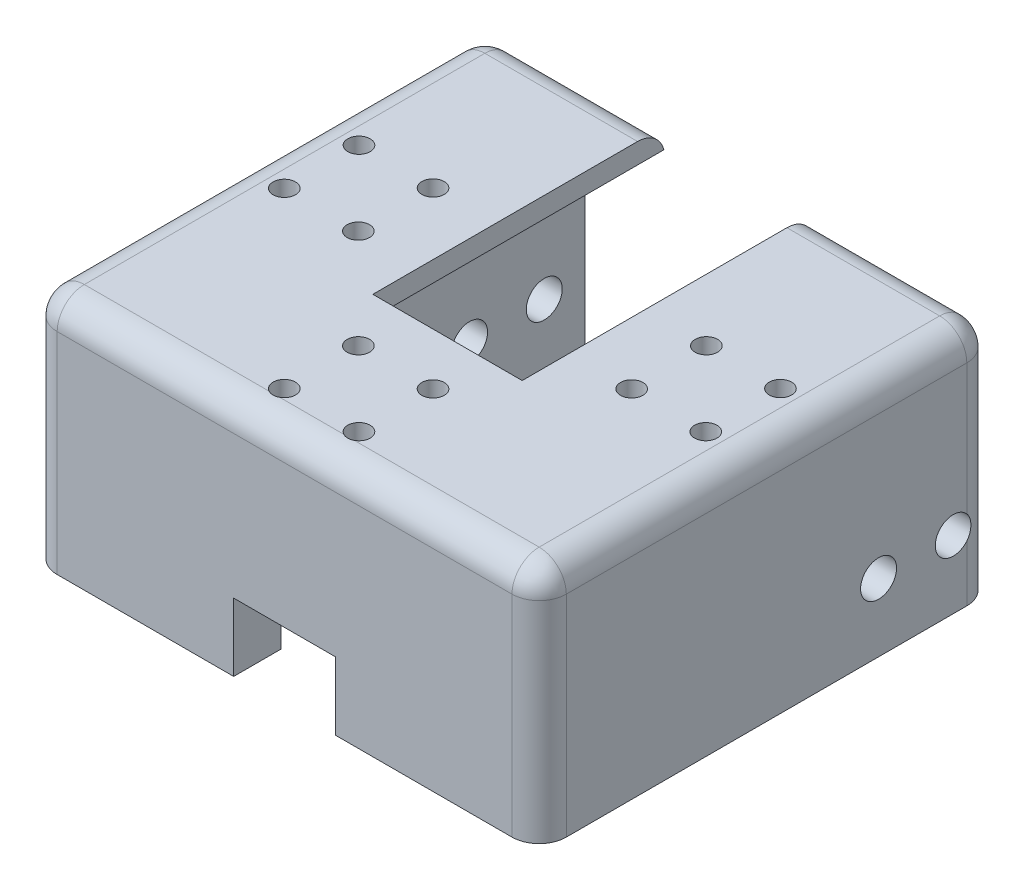
from build123d import *

# Parameters (mm, degrees)
SKETCH1_W                 = 75
SKETCH1_H                 = 35
BOSS_EXTRUDE1_DEPTH       = 67
CUT_EXTRUDE1_DEPTH        = 60
SKETCH4_W                 = 15
SKETCH4_H                 = 10
CUT_EXTRUDE2_DEPTH        = 73.886898686
SKETCH5_W                 = 22
SKETCH5_H                 = 3
CUT_EXTRUDE3_DEPTH        = 43
F_3_0MM_DOWEL_HOLE1_D     = 3.3
F_3_0MM_DOWEL_HOLE1_DEPTH = 10
F_3_0MM_DOWEL_HOLE1_TIP   = 0.991420021
SKETCH8_R                 = 2.65
CUT_EXTRUDE4_DEPTH        = 103.079625783
FILLET1_R                 = 4


with BuildPart() as part:
    # Sketch1 → Boss-Extrude1 (new body)
    with BuildSketch(Plane.XY):
        Rectangle(SKETCH1_W, SKETCH1_H)
    extrude(amount=-BOSS_EXTRUDE1_DEPTH)

    # Sketch2 → Cut-Extrude1 (cut)
    with BuildSketch(Plane(origin=(0, 0, -67), x_dir=(-1, 0, 0), z_dir=(0, 0, -1))):
        Polygon((-22.75, -17.5), (22.75, -17.5), (22.75, 8.5), (11, 14.5), (-11, 14.5), (-22.75, 8.5), align=None)
    extrude(amount=-CUT_EXTRUDE1_DEPTH, mode=Mode.SUBTRACT)

    # Sketch4 → Cut-Extrude2 (cut, through all)
    with BuildSketch(Plane(origin=(0, 0, -7), x_dir=(-1, 0, 0), z_dir=(0, 0, -1))):
        with Locations((0, -12.5)):
            Rectangle(SKETCH4_W, SKETCH4_H)
    extrude(amount=-CUT_EXTRUDE2_DEPTH, mode=Mode.SUBTRACT)

    # Sketch5 → Cut-Extrude3 (cut)
    with BuildSketch(Plane(origin=(0, 0, -67), x_dir=(-1, 0, 0), z_dir=(0, 0, -1))):
        with Locations((0, 16)):
            Rectangle(SKETCH5_W, SKETCH5_H)
    extrude(amount=-CUT_EXTRUDE3_DEPTH, mode=Mode.SUBTRACT)

    # Ø3.0mm Dowel Hole1
    with Locations(Plane(origin=(0, 17.5, 0), x_dir=(1, 0, 0), z_dir=(0, 1, 0))):
        with Locations((-31.04375, 31), (-31.04375, 42), (-20.13125, 42), (-20.13125, 31), (-5.5, 16.36875), (5.5, 16.36875), (-5.5, 5.45625), (5.5, 5.45625), (31.04375, 42), (20.13125, 42), (31.04375, 31), (20.13125, 31)):
            Hole(F_3_0MM_DOWEL_HOLE1_D / 2, depth=F_3_0MM_DOWEL_HOLE1_DEPTH)
            with Locations((0, 0, -(F_3_0MM_DOWEL_HOLE1_DEPTH + F_3_0MM_DOWEL_HOLE1_TIP / 2))):  # 118° drill point
                Cone(0, F_3_0MM_DOWEL_HOLE1_D / 2, F_3_0MM_DOWEL_HOLE1_TIP, mode=Mode.SUBTRACT)

    # Sketch8 → Cut-Extrude4 (cut, through all)
    with BuildSketch(Plane.ZY.offset(37.5)):
        with Locations((-61, -7.5)):
            Circle(SKETCH8_R)
        with Locations((-50, -7.5)):
            Circle(SKETCH8_R)
    extrude(amount=-CUT_EXTRUDE4_DEPTH, mode=Mode.SUBTRACT)

    # Fillet1
    # the kernel refuses this fillet: 4 mm, written as the material it takes off along each edge
    with BuildSketch(Plane(origin=(33.5, 13.5, -4), x_dir=(0, 0, 1), z_dir=(1, 0, 0))) as fillet1_piece_1_section:
        Polygon((0, 0), (FILLET1_R, 0), (FILLET1_R, -FILLET1_R), (0, -FILLET1_R), align=None)
    fillet1_piece_1 = extrude(amount=FILLET1_R, mode=Mode.PRIVATE)
    fillet1_piece_1 = fillet1_piece_1 - Plane(origin=(33.5, 13.5, -4), x_dir=(0, -0.7071067811865475, -0.7071067811865475), z_dir=(1, 0, 0)) * Sphere(FILLET1_R, mode=Mode.PRIVATE)
    add(fillet1_piece_1, mode=Mode.SUBTRACT)
    with BuildSketch(Plane(origin=(-33.5, 13.5, -4), x_dir=(-1, 0, 0), z_dir=(0, 0, 1))) as fillet1_piece_2_section:
        Polygon((0, 0), (FILLET1_R, 0), (FILLET1_R, -FILLET1_R), (0, -FILLET1_R), align=None)
    fillet1_piece_2 = extrude(amount=FILLET1_R, mode=Mode.PRIVATE)
    fillet1_piece_2 = fillet1_piece_2 - Plane(origin=(-33.5, 13.5, -4), x_dir=(0.7071067811865475, -0.7071067811865475, 0), z_dir=(0, 0, 1)) * Sphere(FILLET1_R, mode=Mode.PRIVATE)
    add(fillet1_piece_2, mode=Mode.SUBTRACT)
    with BuildSketch(Plane(origin=(-33.5, 13.5, -63), x_dir=(-1, 0, 0), z_dir=(0, 0, -1))) as fillet1_piece_3_section:
        Polygon((0, 0), (FILLET1_R, 0), (FILLET1_R, FILLET1_R), (0, FILLET1_R), align=None)
    fillet1_piece_3 = extrude(amount=FILLET1_R, mode=Mode.PRIVATE)
    fillet1_piece_3 = fillet1_piece_3 - Plane(origin=(-33.5, 13.5, -63), x_dir=(0.7071067811865475, -0.7071067811865475, 0), z_dir=(0, 0, -1)) * Sphere(FILLET1_R, mode=Mode.PRIVATE)
    add(fillet1_piece_3, mode=Mode.SUBTRACT)
    with BuildSketch(Plane(origin=(33.5, 13.5, -63), x_dir=(0, 1, 0), z_dir=(1, 0, 0))) as fillet1_piece_4_section:
        Polygon((0, 0), (FILLET1_R, 0), (FILLET1_R, -FILLET1_R), (0, -FILLET1_R), align=None)
    fillet1_piece_4 = extrude(amount=FILLET1_R, mode=Mode.PRIVATE)
    fillet1_piece_4 = fillet1_piece_4 - Plane(origin=(33.5, 13.5, -63), x_dir=(0, -0.7071067811865475, 0.7071067811865475), z_dir=(1, 0, 0)) * Sphere(FILLET1_R, mode=Mode.PRIVATE)
    add(fillet1_piece_4, mode=Mode.SUBTRACT)
    with BuildSketch(Plane(origin=(37.5, -27.5, 0), x_dir=(-1, 0, 0), z_dir=(0, 1, 0)), Plane(origin=(-37.5, 13.5, 0), x_dir=(1, 0, 0), z_dir=(0, -1, 0)), Plane(origin=(37.5, -27.5, -67), x_dir=(0, 0, 1), z_dir=(0, 1, 0))) as fillet1_piece_5:
        with BuildLine():
            CenterArc((FILLET1_R, -FILLET1_R), FILLET1_R, 90, 90)
            Line((0, -FILLET1_R), (0, 0))
            Line((0, 0), (FILLET1_R, 0))
        make_face()
    extrude(amount=41, mode=Mode.SUBTRACT)
    with BuildSketch(Plane(origin=(-37.5, 13.5, -67), x_dir=(1, 0, 0), z_dir=(0, -1, 0))) as fillet1_piece_6:
        with BuildLine():
            CenterArc((FILLET1_R, FILLET1_R), FILLET1_R, 180, 90)
            Line((0, FILLET1_R), (0, 0))
            Line((0, 0), (FILLET1_R, 0))
        make_face()
    extrude(amount=41, mode=Mode.SUBTRACT)
    with BuildSketch(Plane(origin=(-1, 17.5, -67), x_dir=(0, -1, 0), z_dir=(-1, 0, 0))) as fillet1_piece_7:
        with BuildLine():
            CenterArc((FILLET1_R, FILLET1_R), FILLET1_R, 180, 90)
            Line((0, FILLET1_R), (0, 0))
            Line((0, 0), (FILLET1_R, 0))
        make_face()
    extrude(amount=32.5, mode=Mode.SUBTRACT)
    with BuildSketch(Plane(origin=(33.5, 17.5, -67), x_dir=(0, 0, 1), z_dir=(-1, 0, 0))) as fillet1_piece_8:
        with BuildLine():
            CenterArc((FILLET1_R, -FILLET1_R), FILLET1_R, 90, 90)
            Line((0, -FILLET1_R), (0, 0))
            Line((0, 0), (FILLET1_R, 0))
        make_face()
    extrude(amount=32.5, mode=Mode.SUBTRACT)
    with BuildSketch(Plane(origin=(37.5, 17.5, -4), x_dir=(-1, 0, 0), z_dir=(0, 0, -1)), Plane(origin=(-37.5, 17.5, -4), x_dir=(0, -1, 0), z_dir=(0, 0, -1))) as fillet1_piece_9:
        with BuildLine():
            CenterArc((FILLET1_R, -FILLET1_R), FILLET1_R, 90, 90)
            Line((0, -FILLET1_R), (0, 0))
            Line((0, 0), (FILLET1_R, 0))
        make_face()
    extrude(amount=59, mode=Mode.SUBTRACT)
    with BuildSketch(Plane(origin=(33.5, 17.5, 0), x_dir=(0, -1, 0), z_dir=(-1, 0, 0))) as fillet1_piece_10:
        with BuildLine():
            CenterArc((FILLET1_R, -FILLET1_R), FILLET1_R, 90, 90)
            Line((0, -FILLET1_R), (0, 0))
            Line((0, 0), (FILLET1_R, 0))
        make_face()
    extrude(amount=67, mode=Mode.SUBTRACT)


solid = part.part
